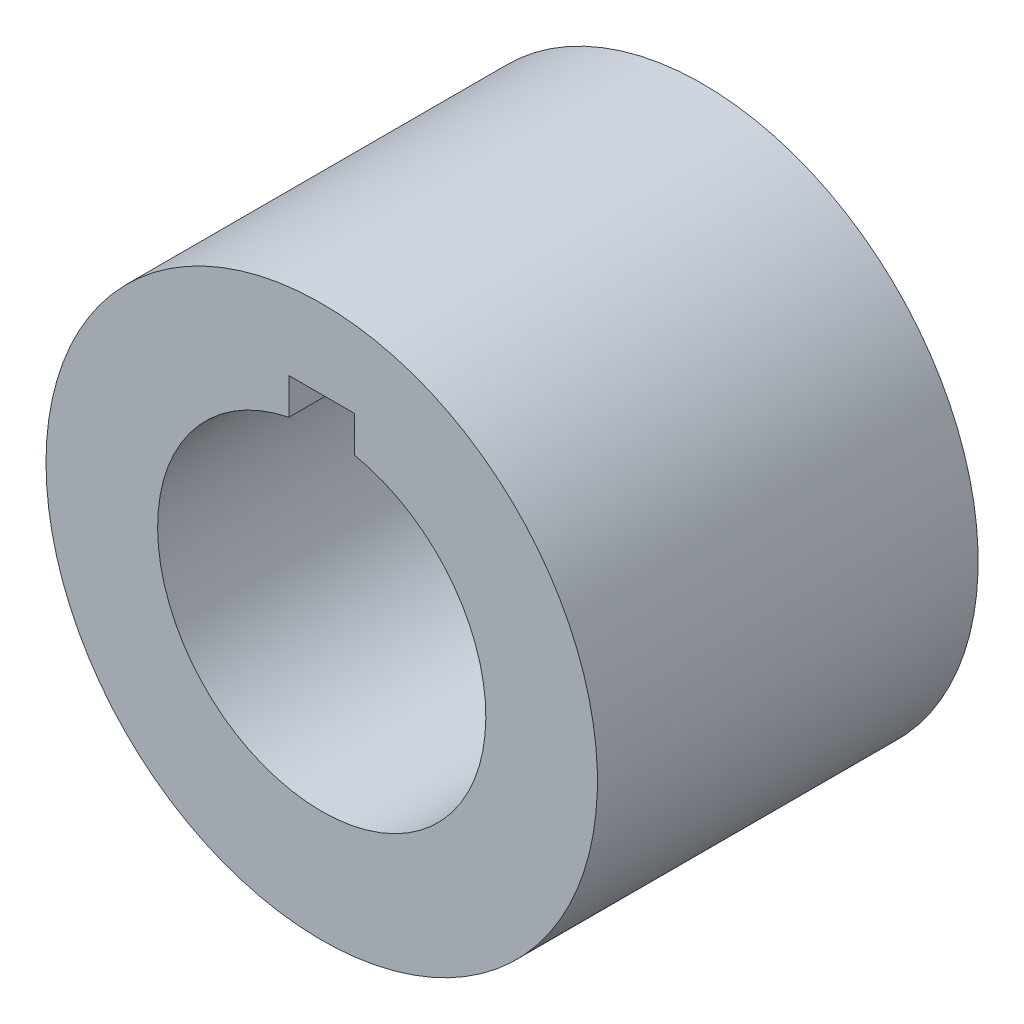
from build123d import *

# Parameters (mm, degrees)
SKETCH1_R           = 21
SKETCH1_R_2         = 12.5
BOSS_EXTRUDE4_DEPTH = 29
SKETCH3_W           = 5
SKETCH3_H           = 5
CUT_EXTRUDE3_DEPTH  = 25.5
FILLET5_R           = 2.5
FILLET6_R           = 2.5


with BuildPart() as part:
    # Sketch1 → Boss-Extrude4 (new body)
    with BuildSketch(Plane.XY):
        with Locations(Location((0, 0, 0), (0, 0, 180))):
            Circle(SKETCH1_R)
        with Locations(Location((0, 0, 0), (0, 0, 180))):
            Circle(SKETCH1_R_2, mode=Mode.SUBTRACT)
    extrude(amount=BOSS_EXTRUDE4_DEPTH)

    # Sketch3 → Cut-Extrude3 (cut)
    with BuildSketch(Plane.XY.offset(29)):
        with Locations((0, 12.5)):
            Rectangle(SKETCH3_W, SKETCH3_H)
    extrude(amount=-CUT_EXTRUDE3_DEPTH, mode=Mode.SUBTRACT)

    # Fillet5
    fillet5_edges = [part.edges().sort_by_distance(p)[0] for p in [
        (2.5, 13.623724357, 3.5),
    ]]
    fillet(fillet5_edges, radius=FILLET5_R)

    # Fillet6
    fillet6_edges = [part.edges().sort_by_distance(p)[0] for p in [
        (-2.5, 13.623724357, 3.5),
    ]]
    fillet(fillet6_edges, radius=FILLET6_R - 0.0001)  # a hair under: the kernel refuses the full size


solid = part.part
